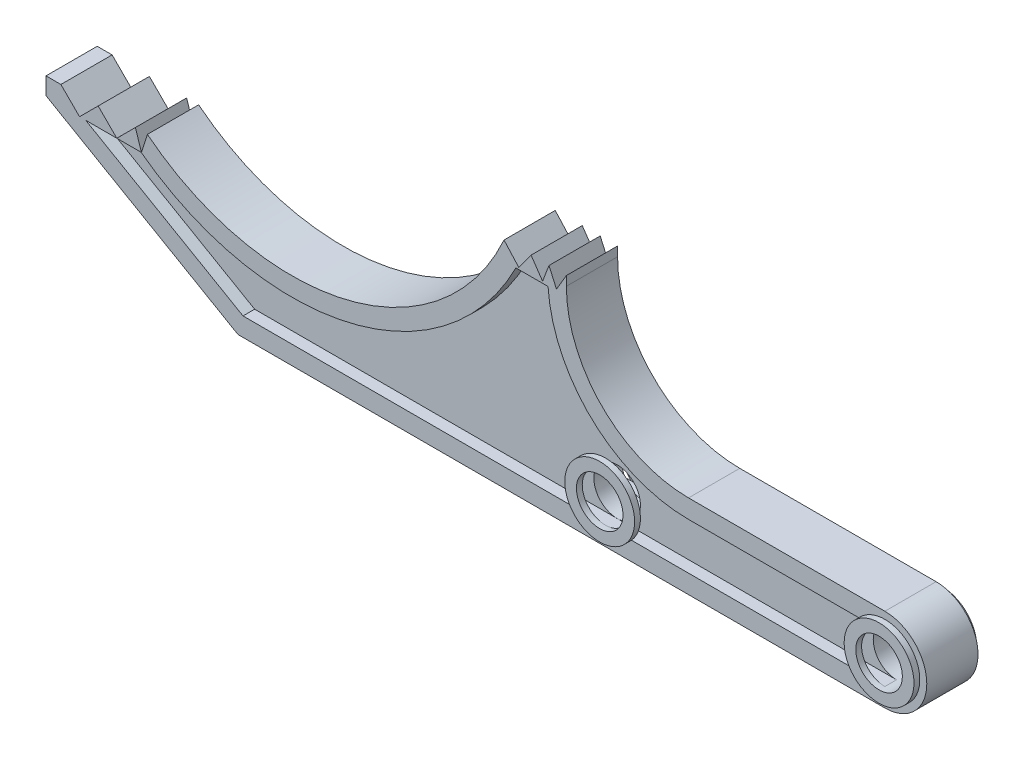
from build123d import *
from build123d.topology import SkipClean

# Parameters (mm, degrees)
BOSS_EXTRUDE1_DEPTH     = 4
SKETCH3_R               = 2.5
CUT_EXTRUDE1_DEPTH      = 82.558227053
CUT_EXTRUDE2_DEPTH      = 1.25
SKETCH5_R               = 3.75
SKETCH5_R_2             = 2.5
BOSS_EXTRUDE2_DEPTH     = 0.625
CUT_EXTRUDE3_DEPTH      = 82.558227053
CUT_EXTRUDE4_START      = -1.25
CUT_EXTRUDE4_DEPTH      = 1.25
CUT_EXTRUDE5_DEPTH      = 79.859241849
CUT_EXTRUDE5_DEPTH_BACK = 79.859241849
CUT_EXTRUDE6_DEPTH      = 79.859241849
CUT_EXTRUDE6_DEPTH_BACK = 79.859241849


with BuildPart() as part:
    # Sketch1 → Boss-Extrude1 (new, symmetric)
    with BuildSketch(Plane.XY):
        with BuildLine():
            Line((0, 0), (70, 0))
            ThreePointArc((70, 0), (76.5, 6.5), (70, 13))
            Line((70, 13), (48.916352203, 13))
            ThreePointArc((48.916352203, 13), (41.053324797, 16.256972593), (37.796352203, 24.12))
            Line((37.796352203, 24.12), (37.796352203, 27.12))
            Line((37.796352203, 27.12), (27.786352203, 27.12))
            ThreePointArc((27.786352203, 27.12), (12.065558159, 13.089935965), (-8.483647797, 17.75))
            Line((-8.483647797, 17.75), (-22.083647797, 17.75))
            Line((-22.083647797, 17.75), (-22.083647797, 12.75))
            Line((-22.083647797, 12.75), (0, 0))
        make_face()
    extrude(amount=BOSS_EXTRUDE1_DEPTH, both=True)

    # Sketch3 → Cut-Extrude1 (cut, through all)
    with BuildSketch(Plane(origin=(0, 0, -4), x_dir=(-1, 0, 0), z_dir=(0, 0, -1))):
        with Locations((-70, 6.5)):
            Circle(SKETCH3_R)
        with Locations((-40, 6.5)):
            Circle(SKETCH3_R)
    extrude(amount=-CUT_EXTRUDE1_DEPTH, mode=Mode.SUBTRACT)

    # Sketch4 → Cut-Extrude2 (cut)
    with BuildSketch(Plane.XY.offset(4)):
        with BuildLine():
            Line((-20.083647797, 13.904700538), (0.535898385, 2))
            Line((0.535898385, 2), (70, 2))
            ThreePointArc((70, 2), (74.5, 6.5), (70, 11))
            Line((70, 11), (48.916352203, 11))
            ThreePointArc((48.916352203, 11), (39.639111234, 14.842759031), (35.796352203, 24.12))
            Line((35.796352203, 24.12), (35.796352203, 25.12))
            Line((35.796352203, 25.12), (29.119764251, 25.12))
            ThreePointArc((29.119764251, 25.12), (12.251390397, 11.074453376), (-9.195256898, 15.75))
            Line((-9.195256898, 15.75), (-20.083647797, 15.75))
            Line((-20.083647797, 15.75), (-20.083647797, 13.904700538))
        make_face()
    cut_extrude2 = extrude(amount=-CUT_EXTRUDE2_DEPTH, mode=Mode.SUBTRACT)

    # Sketch5 → Boss-Extrude2 (add, symmetric)
    # profile 1 of 2: a face of its own
    with SkipClean():  # the faces are left unmerged after this step: merging them gives an invalid solid
        with BuildSketch(Plane.XY.offset(2.75)):
            with Locations((40, 6.5)):
                Circle(SKETCH5_R)
            with Locations((40, 6.5)):
                Circle(SKETCH5_R_2, mode=Mode.SUBTRACT)
        # profile 2 of 2: a face of its own
        with BuildSketch(Plane.XY.offset(2.75)):
            with Locations((70, 6.5)):
                Circle(SKETCH5_R)
            with Locations((70, 6.5)):
                Circle(SKETCH5_R_2, mode=Mode.SUBTRACT)
        boss_extrude2 = extrude(amount=BOSS_EXTRUDE2_DEPTH, both=True)

    # Mirror1: Cut-Extrude2, Boss-Extrude2 across plane
    add(cut_extrude2.mirror(Plane.XY), mode=Mode.SUBTRACT)
    add(boss_extrude2.mirror(Plane.XY))

    # Sketch7 → Cut-Extrude3 (cut, through all)
    with BuildSketch(Plane.XY.offset(4)):
        with BuildLine():
            Line((-22.083647797, 17.75), (-22.083647797, 12.75))
            Line((-22.083647797, 12.75), (0, 0))
            Line((0, 0), (70, 0))
            ThreePointArc((70, 0), (76.5, 6.5), (70, 13))
            Line((70, 13), (48.916352203, 13))
            ThreePointArc((48.916352203, 13), (41.053324797, 16.256972593), (37.796352203, 24.12))
            Line((37.796352203, 24.12), (37.796352203, 27.12))
            Line((37.796352203, 27.12), (27.786352203, 27.12))
            ThreePointArc((27.786352203, 27.12), (12.065558159, 13.089935965), (-8.483647797, 17.75))
            Line((-8.483647797, 17.75), (-22.083647797, 17.75))
        make_face()
        with BuildLine():
            Line((70, 2), (0.535898385, 2))
            Line((0.535898385, 2), (-20.083647797, 13.904700538))
            Line((-20.083647797, 13.904700538), (-20.083647797, 15.75))
            Line((-20.083647797, 15.75), (-9.195256898, 15.75))
            ThreePointArc((-9.195256898, 15.75), (12.251390397, 11.074453376), (29.119764251, 25.12))
            Line((29.119764251, 25.12), (35.796352203, 25.12))
            Line((35.796352203, 25.12), (35.796352203, 24.12))
            ThreePointArc((35.796352203, 24.12), (39.639111234, 14.842759031), (48.916352203, 11))
            Line((48.916352203, 11), (70, 11))
            ThreePointArc((70, 11), (74.5, 6.5), (70, 2))
        make_face(mode=Mode.SUBTRACT)
    cut_extrude3 = extrude(amount=-CUT_EXTRUDE3_DEPTH, mode=Mode.SUBTRACT)

    # Sketch8 → Cut-Extrude4 (cut)
    with BuildSketch(Plane.XY.offset(2.75).offset(CUT_EXTRUDE4_START)):
        with BuildLine():
            Line((-15.815698604, 13.75), (1.07179677, 4))
            Line((1.07179677, 4), (70, 4))
            ThreePointArc((70, 4), (72.5, 6.5), (70, 9))
            Line((70, 9), (48.916352203, 9))
            ThreePointArc((48.916352203, 9), (38.584498546, 13.080652193), (33.829457228, 23.12))
            Line((33.829457228, 23.12), (30.37941216, 23.12))
            ThreePointArc((30.37941216, 23.12), (12.433656393, 9.061817656), (-9.875614934, 13.75))
            Line((-9.875614934, 13.75), (-15.815698604, 13.75))
        make_face()
    cut_extrude4 = extrude(amount=CUT_EXTRUDE4_DEPTH, mode=Mode.SUBTRACT)

    # Mirror2: Cut-Extrude3, Cut-Extrude4 across plane
    add(cut_extrude3.mirror(Plane.XY), mode=Mode.SUBTRACT)
    add(cut_extrude4.mirror(Plane.XY), mode=Mode.SUBTRACT)

    # Sketch9 → Cut-Extrude5 (cut, two sides: drawn at the far end of the back side and taken through both)
    with BuildSketch(Plane.XY.offset(2.75).offset(-CUT_EXTRUDE5_DEPTH_BACK)):
        Polygon((-158.483427763, 155.749779966), (-18.483647797, 15.75), (-16.482535606, 13.748887809), (-14.481423415, 15.75), (-12.480311224, 13.748887809), (-10.479199033, 15.75), (-9.839204987, 13.748887809), (-9.195256898, 15.75), (51.453981857, 204.221606933), (-37.628855278, 590.05026742), (-247.566264898, 541.578440454), align=None)
    extrude(amount=CUT_EXTRUDE5_DEPTH + CUT_EXTRUDE5_DEPTH_BACK, mode=Mode.SUBTRACT)

    # Sketch11 → Cut-Extrude6 (cut, two sides: drawn at the far end of the back side and taken through both)
    with BuildSketch(Plane.XY.offset(2.75).offset(-CUT_EXTRUDE6_DEPTH_BACK)):
        Polygon((-58.744613452, 122.187820826), (29.099875124, 25.075811319), (30.688127166, 23.32), (32.002745662, 25.12), (33.242951791, 23.32), (33.9290832, 25.12), (34.735542366, 23.32), (35.796352203, 25.12), (102.28212416, 137.934177705), (76.793604285, 398.587053404), (-84.233133328, 382.840696525), align=None)
    extrude(amount=CUT_EXTRUDE6_DEPTH + CUT_EXTRUDE6_DEPTH_BACK, mode=Mode.SUBTRACT)


solid = part.part
